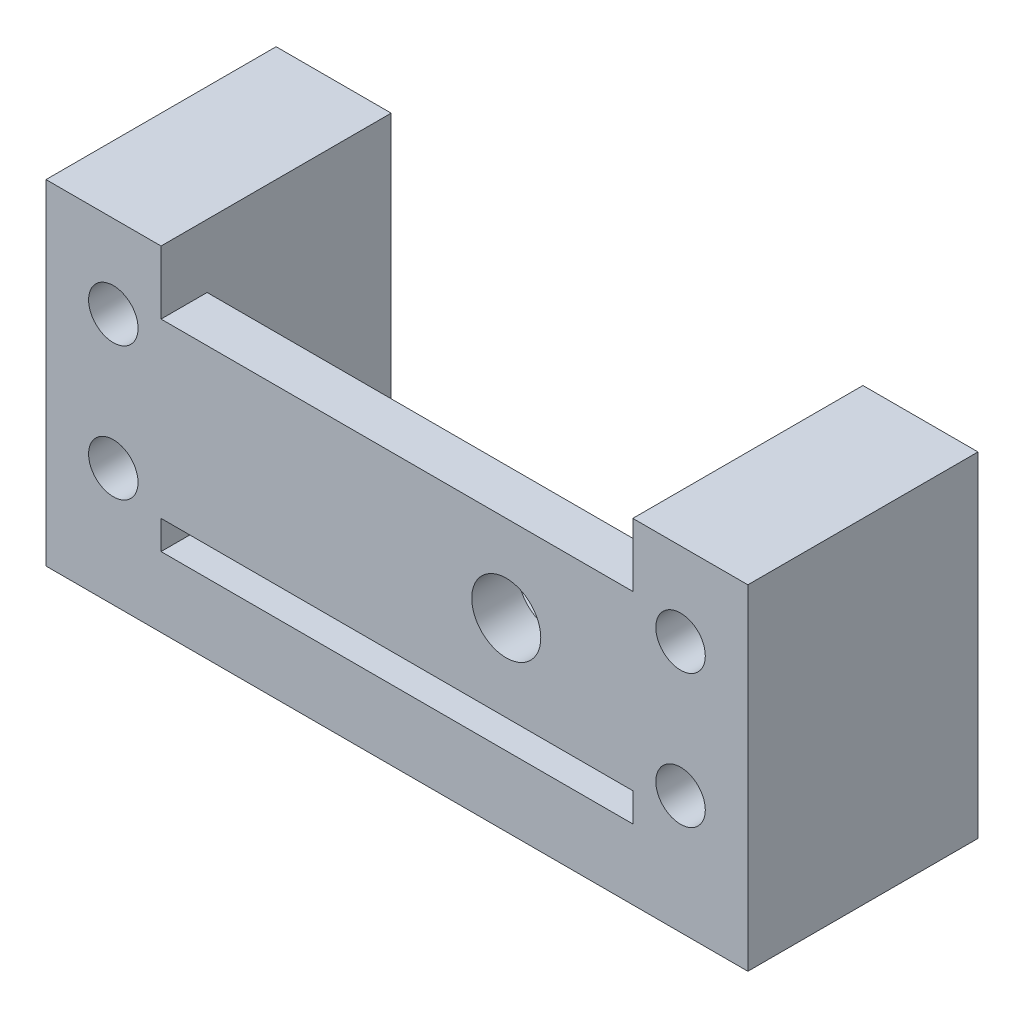
from build123d import *

# Parameters (mm, degrees)
EXTRUDE_1_DEPTH     = 20
SKETCH_5_R          = 3
EXTRUDE_6_DEPTH     = 4
SKETCH_6_R          = 2.15
CUT_EXTRUDE_2_DEPTH = 79.076136853


with BuildPart() as part:
    # Эскиз1 → Бобышка-Вытянуть1 (new body)
    with BuildSketch(Plane.XY):
        Polygon((-61.190561798, -40.176897727), (-61.190561798, -15.085730337), (-51.190561798, -15.085730337), (-51.190561798, -38.085730337), (-10.190561798, -38.085730337), (-10.190561798, -15.085730337), (-0.190561798, -15.085730337), (-0.190561798, -38.085730337), (-0.190561798, -44.176897727), (-61.190561798, -44.176897727), align=None)
    extrude(amount=EXTRUDE_1_DEPTH)

    # Эскиз5 → Бобышка-Вытянуть6 (add)
    with BuildSketch(Plane.XY.offset(20)):
        Polygon((-21.190561798, -35.58573034), (-51.190561798, -35.58573034), (-51.190561798, -20.58573034), (-21.190561798, -20.58573034), (-10.190561798, -20.58573034), (-10.190561798, -35.58573034), align=None)
        with Locations((-21.190561798, -28.085730337)):
            Circle(SKETCH_5_R, mode=Mode.SUBTRACT)
    extrude(amount=-EXTRUDE_6_DEPTH)

    # Эскиз6 → Вырез-Вытянуть2 (cut, through all)
    with BuildSketch(Plane.XY.offset(20)):
        with Locations((-6.040561798, -33.885730337)):
            Circle(SKETCH_6_R)
        with Locations((-6.040561798, -22.285730337)):
            Circle(SKETCH_6_R)
        with Locations((-55.340561798, -22.285730337)):
            Circle(SKETCH_6_R)
        with Locations((-55.340561798, -33.885730337)):
            Circle(SKETCH_6_R)
    extrude(amount=-CUT_EXTRUDE_2_DEPTH, mode=Mode.SUBTRACT)


solid = part.part
